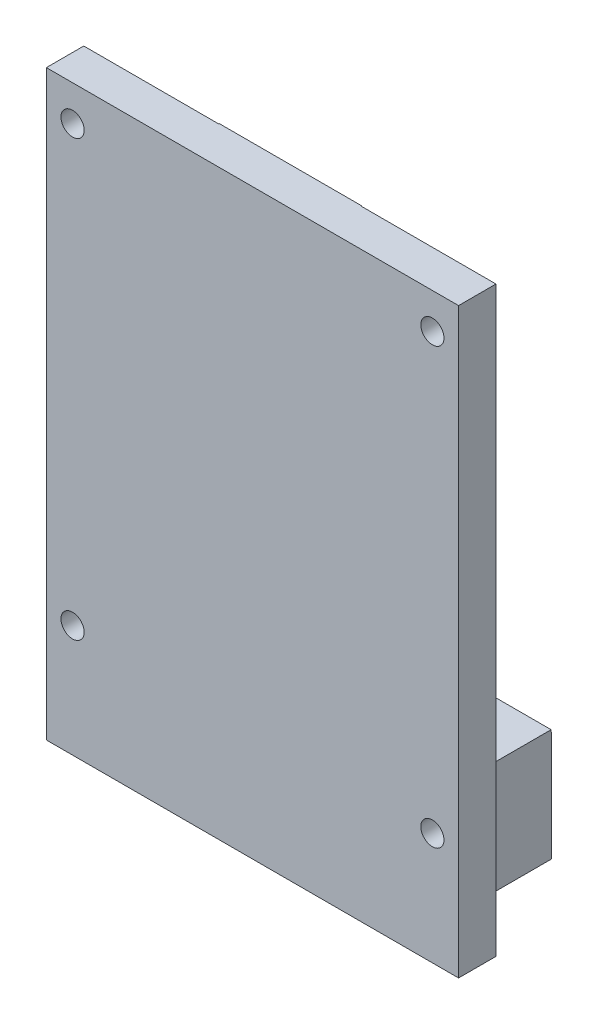
from build123d import *

# Parameters (mm, degrees)
SKETCH_1_W          = 65
SKETCH_1_H          = 100
EXTRUDE_1_DEPTH     = 5
SKETCH_3_W          = 65
SKETCH_3_H          = 15
EXTRUDE_2_DEPTH     = 15
SKETCH_4_R          = 1.675
CUT_EXTRUDE_1_DEPTH = 15
SKETCH_8_R          = 1.55
CUT_EXTRUDE_2_DEPTH = 15
EXTRUDE_4_DEPTH     = 19
SKETCH_10_W         = 12.51
SKETCH_10_H         = 20.752848232
SKETCH_10_H_2       = 21.550243719
CUT_EXTRUDE_3_DEPTH = 93.229333728
SKETCH_11_W         = 65
SKETCH_11_H         = 22.160800115
CUT_EXTRUDE_4_DEPTH = 10
FILLET_START        = -21
FILLET_1_DEPTH      = 42
SKETCH_12_W         = 13.248565373
SKETCH_12_H         = 85.777871489
SKETCH_12_W_2       = 8.637190958
SKETCH_12_H_2       = 86.586054809
CUT_EXTRUDE_6_DEPTH = 10


with BuildPart() as part:
    # 草图1 → 凸台-拉伸1 (new body)
    with BuildSketch(Plane.XY):
        Rectangle(SKETCH_1_W, SKETCH_1_H)
    extrude(amount=EXTRUDE_1_DEPTH)

    # 草图3 → 凸台-拉伸2 (add)
    with BuildSketch(Plane(origin=(0, 0, 0), x_dir=(-1, 0, 0), z_dir=(0, 0, -1))):
        with Locations((0, -42.5)):
            Rectangle(SKETCH_3_W, SKETCH_3_H)
    extrude(amount=EXTRUDE_2_DEPTH)

    # 草图4 → 切除-拉伸1 (cut)
    with BuildSketch(Plane(origin=(0, -35, 0), x_dir=(1, 0, 0), z_dir=(0, 1, 0))):
        with Locations(Location((-14.99, 10, 0), (0, 0, 270))):
            Circle(SKETCH_4_R)
        with Locations(Location((14.99, 10, 0), (0, 0, 270))):
            Circle(SKETCH_4_R)
    extrude(amount=-CUT_EXTRUDE_1_DEPTH, mode=Mode.SUBTRACT)

    # 草图8 → 切除-拉伸2 (cut)
    with BuildSketch(Plane.XY.offset(5)):
        with Locations((-24.05, 23.1)):
            Circle(SKETCH_8_R)
        with Locations((24.05, 23.1)):
            Circle(SKETCH_8_R)
        with Locations((-24.05, -35)):
            Circle(SKETCH_8_R)
        with Locations((24.05, -35)):
            Circle(SKETCH_8_R)
    extrude(amount=-CUT_EXTRUDE_2_DEPTH, mode=Mode.SUBTRACT)

    # 草图9 → 凸台-拉伸4 (add)
    with BuildSketch(Plane(origin=(9.5, 0, 0), x_dir=(0, 0, -1), z_dir=(1, 0, 0))):
        Polygon((15, -35), (0, -35), (0, 28.153160969), align=None)
    extrude(amount=-EXTRUDE_4_DEPTH)

    # 草图10 → 切除-拉伸3 (cut, through all)
    with BuildSketch(Plane(origin=(0, -35, 0), x_dir=(1, 0, 0), z_dir=(0, 1, 0))):
        with Locations((26.245, 10.376424116)):
            Rectangle(SKETCH_10_W, SKETCH_10_H)
        with Locations((-26.245, 10.77512186)):
            Rectangle(SKETCH_10_W, SKETCH_10_H_2)
    extrude(amount=-CUT_EXTRUDE_3_DEPTH, mode=Mode.SUBTRACT)

    # 草图11 → 切除-拉伸4 (cut)
    with BuildSketch(Plane.XY.offset(5)):
        with Locations((0, 38.919599942)):
            Rectangle(SKETCH_11_W, SKETCH_11_H)
    extrude(amount=-CUT_EXTRUDE_4_DEPTH, mode=Mode.SUBTRACT)

    # 圆角1: read off the stored shape, not the designer's step
    # 圆角1 outline → 圆角1 (cut)
    with BuildSketch(Plane.YZ.offset(FILLET_START)):
        with BuildLine():
            Line((-36.171296068, -15), (-35, -15))
            Line((-35, -15), (-33.860407805, -14.729326566))
            add(Edge.make_bspline(
                [(-33.860407805, -14.729326566), (-34.0852258, -14.782724842), (-34.31196566, -14.829719593), (-34.540261945, -14.87017776), (-34.769736346, -14.904008746), (-35.233444691, -14.958699176), (-35.467701672, -14.979373092), (-35.702365681, -14.993139997), (-35.937031343, -15), (-36.171296068, -15)],
                knots=[0.503429998, 0.503429998, 0.503429998, 0.503429998, 0.503429998, 0.503429998, 1, 1, 1, 1, 1.503429998, 1.503429998, 1.503429998, 1.503429998, 1.503429998, 1.503429998], degree=5, weights=[1, 1, 0.99999889, 0.999998883, 1, 1, 0.999998819, 0.999998827, 1, 1]))
        make_face()
    extrude(amount=FILLET_1_DEPTH, mode=Mode.SUBTRACT)

    # 草图12 → 切除-拉伸6 (cut)
    with BuildSketch(Plane(origin=(0, 0, 0), x_dir=(-1, 0, 0), z_dir=(0, 0, -1))):
        with Locations((-34.174282686, -10.092547721)):
            Rectangle(SKETCH_12_W, SKETCH_12_H)
        with Locations((31.868595479, -11.75852662)):
            Rectangle(SKETCH_12_W_2, SKETCH_12_H_2)
    extrude(amount=-CUT_EXTRUDE_6_DEPTH, mode=Mode.SUBTRACT)


solid = part.part
